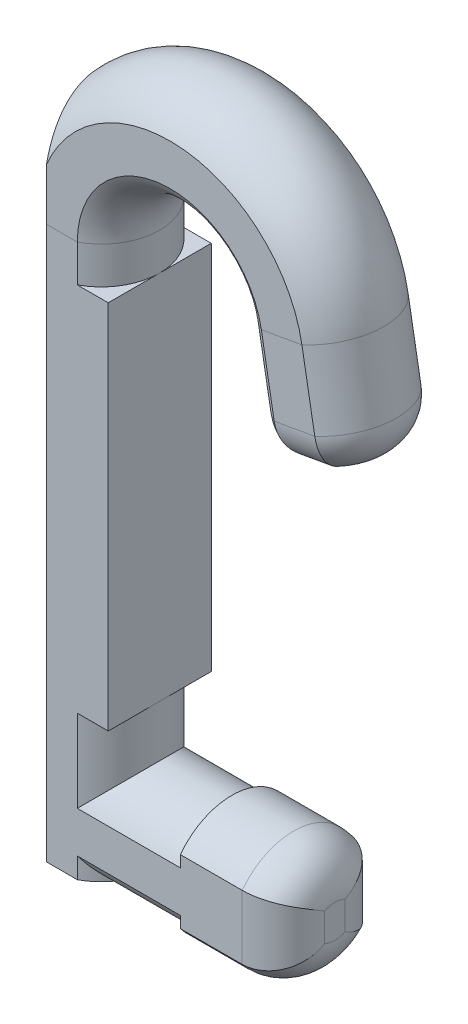
from build123d import *

# Parameters (mm, degrees)
EXTRUDE_1_DEPTH     = 5
SKETCH_19_W         = 5
SKETCH_19_H         = 18
EXTRUDE_2_DEPTH     = 1.5
FILLET_2_R          = 2
SKETCH_20_W         = 8
SKETCH_20_H         = 40
CUT_EXTRUDE_1_DEPTH = 36.961786675


with BuildPart() as part:
    # 扫描2: sweep along a path in 草图1
    with BuildLine(Plane.XY) as sweep_2_path:
        Line((11.886241035, 20.255064977), (10.916442642, 25.755064977))
        ThreePointArc((10.916442642, 25.755064977), (5.020643415, 30.27907084), (0, 24.8))
        Line((0, 24.8), (0, 0))
        Line((0, 0), (0, -2))
    # 草图13 → 扫描2 (sweep)
    with BuildSketch(Plane(origin=(0, -2, 0), x_dir=(1, 0, 0), z_dir=(0, 1, 0))):
        with BuildLine():
            Line((-1, -2.5), (1, -2.5))
            ThreePointArc((1, -2.5), (2.5, 0), (1, 2.5))
            Line((1, 2.5), (-1, 2.5))
            ThreePointArc((-1, 2.5), (-2.5, 0), (-1, -2.5))
        make_face()
    sweep(path=sweep_2_path.line)

    # 扫描4: sweep along a path in 草图15
    with BuildLine(Plane.XY) as sweep_4_path:
        Line((0, 0), (11, 0))
    # 草图16 → 扫描4 (sweep)
    with BuildSketch(Plane(origin=(11, 0, 0), x_dir=(0, 0, -1), z_dir=(1, 0, 0))):
        with BuildLine():
            Line((-2.5, -1), (-2.5, 1))
            ThreePointArc((-2.5, 1), (0, 2.5), (2.5, 1))
            Line((2.5, 1), (2.5, -1))
            ThreePointArc((2.5, -1), (0, -2.5), (-2.5, -1))
        make_face()
    sweep(path=sweep_4_path.line)

    # 草图17 → 凸台-拉伸1 (add)
    with BuildSketch(Plane(origin=(11, 0, 0), x_dir=(0, 0, -1), z_dir=(1, 0, 0))):
        with BuildLine():
            Line((-2.5, 1.555522876), (-2.5, -1.555522876))
            ThreePointArc((-2.5, -1.555522876), (0, -2.8), (2.5, -1.555522876))
            Line((2.5, -1.555522876), (2.5, 1.555522876))
            ThreePointArc((2.5, 1.555522876), (0, 2.8), (-2.5, 1.555522876))
        make_face()
    extrude(amount=-EXTRUDE_1_DEPTH)

    # 草图19 → 凸台-拉伸2 (add)
    with BuildSketch(Plane(origin=(1, 0, 0), x_dir=(0, 0, -1), z_dir=(1, 0, 0))):
        with Locations((0, 14)):
            Rectangle(SKETCH_19_W, SKETCH_19_H)
    extrude(amount=EXTRUDE_2_DEPTH)

    # 圆角2
    # the kernel refuses this fillet: 2 mm, written as the material it takes off along each edge
    with BuildSketch(Plane(origin=(17.795087554, 21.296954043, 2.5), x_dir=(0, 0, -1), z_dir=(-0.9848077530122092, -0.17364817766692373, 0))) as fillet_2_piece_1:
        with BuildLine():
            CenterArc((FILLET_2_R, -FILLET_2_R), FILLET_2_R, 90, 90)
            Line((0, -FILLET_2_R), (0, 0))
            Line((0, 0), (FILLET_2_R, 0))
        make_face()
    extrude(amount=12, mode=Mode.SUBTRACT)
    with BuildSketch(Plane(origin=(12.214510286, 20.312947703, 0), x_dir=(0.9423506208781959, 0.16616183974819204, -0.29045748456869663), z_dir=(0.2860447827236766, 0.05043741288507259, 0.9568878981667733))) as fillet_2_piece_2:
        with BuildLine():
            CenterArc((2.833333333 - FILLET_2_R, FILLET_2_R), FILLET_2_R, 270, 90)
            Line((2.833333333 - FILLET_2_R, 0), (2.833333333, 0))
            Line((2.833333333, 0), (2.833333333, FILLET_2_R))
        make_face()
    revolve(axis=Axis((12.214510286, 20.312947703, 0), (-0.173648177666923, 0.9848077530122094, 0)), revolution_arc=326.229306127, mode=Mode.SUBTRACT)
    with BuildSketch(Plane(origin=(5.977394517, 19.213175911, -2.5), x_dir=(-0.17364817766692373, 0.9848077530122092, 0), z_dir=(0.9848077530122092, 0.17364817766692373, 0))) as fillet_2_piece_3:
        with BuildLine():
            CenterArc((FILLET_2_R, FILLET_2_R), FILLET_2_R, 180, 90)
            Line((0, FILLET_2_R), (0, 0))
            Line((0, 0), (FILLET_2_R, 0))
        make_face()
    extrude(amount=12, mode=Mode.SUBTRACT)
    with BuildSketch(Plane(origin=(11, -6.555522876, 2.5), x_dir=(0, 0, -1), z_dir=(0, 1, 0))) as fillet_2_piece_4:
        with BuildLine():
            CenterArc((FILLET_2_R, FILLET_2_R), FILLET_2_R, 180, 90)
            Line((0, FILLET_2_R), (0, 0))
            Line((0, 0), (FILLET_2_R, 0))
        make_face()
    extrude(amount=13.111045751, mode=Mode.SUBTRACT)
    with BuildSketch(Plane(origin=(11, 6.555522876, -2.5), x_dir=(-1, 0, 0), z_dir=(0, -1, 0))) as fillet_2_piece_5:
        with BuildLine():
            CenterArc((FILLET_2_R, -FILLET_2_R), FILLET_2_R, 90, 90)
            Line((0, -FILLET_2_R), (0, 0))
            Line((0, 0), (FILLET_2_R, 0))
        make_face()
    extrude(amount=13.111045751, mode=Mode.SUBTRACT)
    with BuildSketch(Plane(origin=(11, -0.333333333, 0), x_dir=(0, -0.8131785022115455, -0.582014367125922), z_dir=(0, -0.582014367125922, 0.8131785022115455))) as fillet_2_piece_6:
        with BuildLine():
            CenterArc((3.133333333 - FILLET_2_R, -FILLET_2_R), FILLET_2_R, 0, 90)
            Line((3.133333333, -FILLET_2_R), (3.133333333, 0))
            Line((3.133333333, 0), (3.133333333 - FILLET_2_R, 0))
        make_face()
    revolve(axis=Axis((11, -0.333333333, 0), (1, 0, 0)), revolution_arc=288.815304863, mode=Mode.SUBTRACT)
    with BuildSketch(Plane(origin=(11, 0.333333333, 0), x_dir=(0, 0.8131785022115376, 0.5820143671259329), z_dir=(0, 0.5820143671259329, -0.8131785022115376))) as fillet_2_piece_7:
        with BuildLine():
            CenterArc((3.133333333 - FILLET_2_R, -FILLET_2_R), FILLET_2_R, 0, 90)
            Line((3.133333333 - FILLET_2_R, 0), (3.133333333, 0))
            Line((3.133333333, 0), (3.133333333, -FILLET_2_R))
        make_face()
    revolve(axis=Axis((11, 0.333333333, 0), (1, 0, 0)), revolution_arc=288.815304863, mode=Mode.SUBTRACT)
    with BuildSketch(Plane(origin=(11.557971784, 20.197182251, 0), x_dir=(-0.9423506208781961, -0.16616183974819207, 0.2904574845686964), z_dir=(-0.2860447827236764, -0.05043741288507257, -0.9568878981667737))) as fillet_2_piece_8:
        with BuildLine():
            CenterArc((2.833333333 - FILLET_2_R, FILLET_2_R), FILLET_2_R, 270, 90)
            Line((2.833333333, FILLET_2_R), (2.833333333, 0))
            Line((2.833333333, 0), (2.833333333 - FILLET_2_R, 0))
        make_face()
    revolve(axis=Axis((11.557971784, 20.197182251, 0), (-0.17364817766692306, 0.9848077530122095, 0)), revolution_arc=326.229306127, mode=Mode.SUBTRACT)

    # 草图20 → 切除-拉伸1 (cut, through all)
    with BuildSketch(Plane(origin=(-0.5, 0, 0), x_dir=(0, 0, -1), z_dir=(1, 0, 0))):
        with Locations((0, 16)):
            Rectangle(SKETCH_20_W, SKETCH_20_H)
    extrude(amount=-CUT_EXTRUDE_1_DEPTH, mode=Mode.SUBTRACT)


solid = part.part
